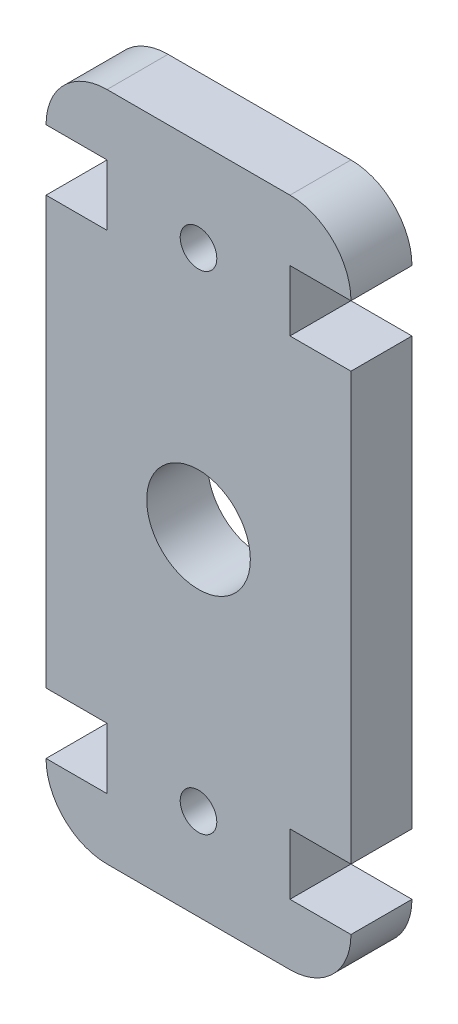
from build123d import *

# Parameters (mm, degrees)
ESQUISSE1_R        = 1.5
ESQUISSE1_R_2      = 4.25
BOSS_EXTRU_1_DEPTH = 5
CONG_1_R           = 5


with BuildPart() as part:
    # Esquisse1 → Boss.-Extru.1 (new body)
    with BuildSketch(Plane.XY):
        Polygon((-12.5, 0), (12.5, 0), (12.5, 5), (7.5, 5), (7.5, 10), (12.5, 10), (12.5, 45), (7.5, 45), (7.5, 50), (12.5, 50), (12.5, 55), (-12.5, 55), (-12.5, 50), (-7.5, 50), (-7.5, 45), (-12.5, 45), (-12.5, 10), (-7.5, 10), (-7.5, 5), (-12.5, 5), align=None)
        with Locations((0, 47.5)):
            Circle(ESQUISSE1_R, mode=Mode.SUBTRACT)
        with Locations((0, 7.5)):
            Circle(ESQUISSE1_R, mode=Mode.SUBTRACT)
        with Locations((0, 27.5)):
            Circle(ESQUISSE1_R_2, mode=Mode.SUBTRACT)
    extrude(amount=BOSS_EXTRU_1_DEPTH)

    # Congé1
    cong_1_edges = [part.edges().sort_by_distance(p)[0] for p in [
        (12.5, 55, 2.5),
        (12.5, 0, 2.5),
        (-12.5, 0, 2.5),
        (-12.5, 55, 2.5),
    ]]
    fillet(cong_1_edges, radius=CONG_1_R - 0.0001)  # a hair under: the kernel refuses the full size


solid = part.part
